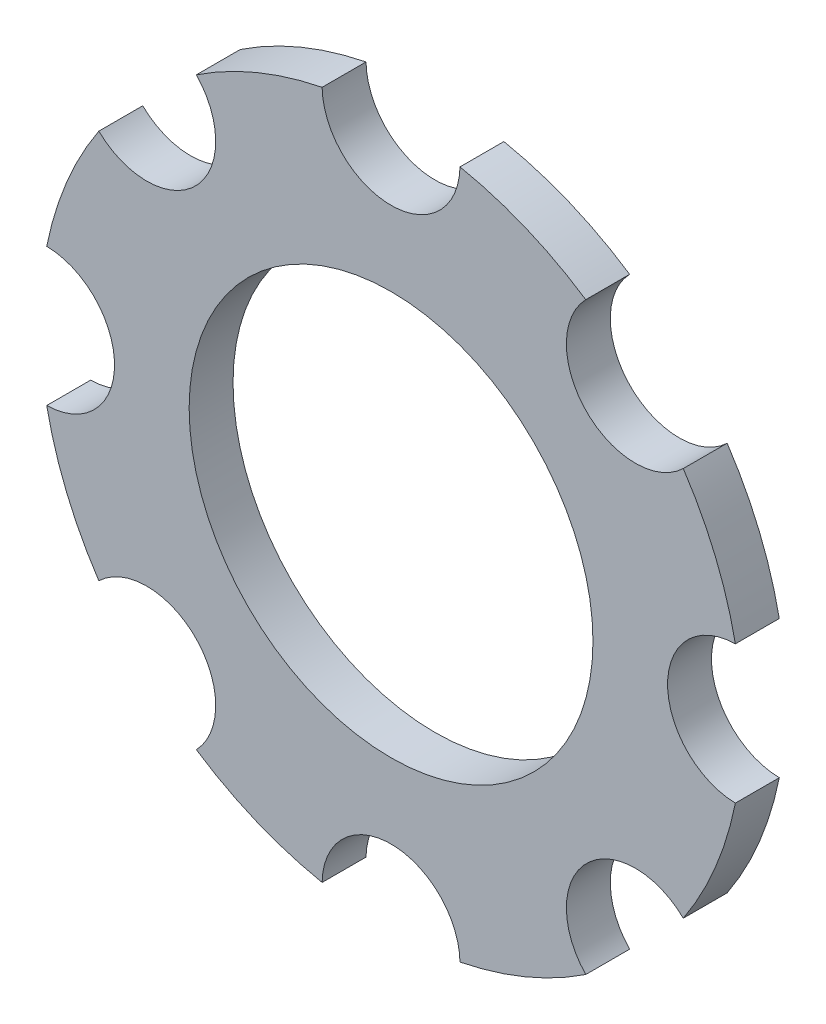
from build123d import *

# Parameters (mm, degrees)
SKETCH1_R          = 4
SKETCH1_R_2        = 2.3
BASE_EXTRUDE_DEPTH = 0.5
TYPEASLOT_DEPTH    = 9.638143663
TYPEAPATTERN_COUNT = 8


with BuildPart() as part:
    # Sketch1 → Base-Extrude (new body)
    with BuildSketch(Plane.XY):
        Circle(SKETCH1_R)
        Circle(SKETCH1_R_2, mode=Mode.SUBTRACT)
    extrude(amount=-BASE_EXTRUDE_DEPTH)

    # Sketch2 → TypeASlot (cut, through all)
    with BuildSketch(Plane(origin=(-1.609342, -2.550023532, 0), x_dir=(1, 0, 0), z_dir=(0, 0, 1))):
        with BuildLine():
            Line((0.8239445, 16.485421032), (0.8239445, 6.485421032))
            ThreePointArc((0.8239445, 6.485421032), (1.609342, 5.700023532), (2.3947395, 6.485421032))
            Line((2.3947395, 6.485421032), (2.3947395, 16.485421032))
            Line((2.3947395, 16.485421032), (0.8239445, 16.485421032))
        make_face()
    typeaslot = extrude(amount=-TYPEASLOT_DEPTH, mode=Mode.SUBTRACT)

    # TypeAPattern: TypeASlot ×8 about axis
    typeapattern_axis = Axis((0, 0, -0.5), (0, 0, 1))
    for i in range(1, TYPEAPATTERN_COUNT):
        add(typeaslot.rotate(typeapattern_axis, i * 360 / TYPEAPATTERN_COUNT), mode=Mode.SUBTRACT)


solid = part.part
